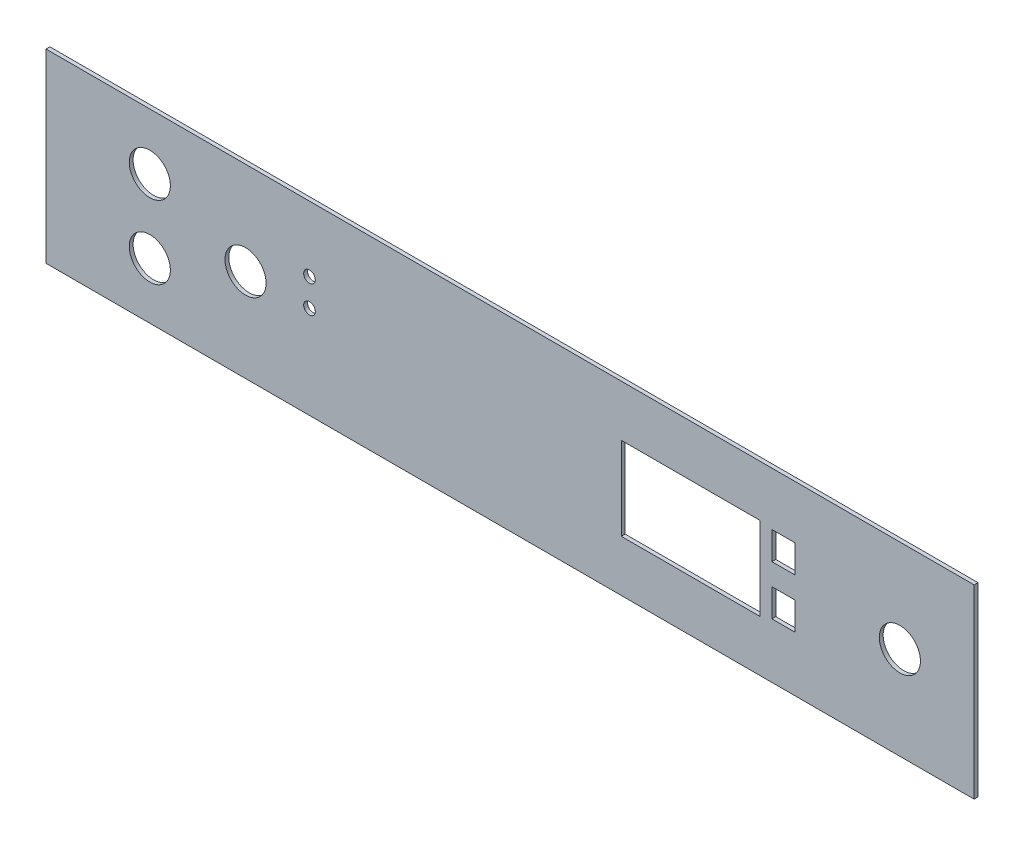
from build123d import *

# Parameters (mm, degrees)
SKETCH1_W             = 508
SKETCH1_H             = 101.6
FRONT_PANEL_DEPTH     = 2.1
SKETCH2_R             = 11.25
START_STOP_DEPTH      = 260.038703672
SKETCH3_R             = 11.25
SKETCH3_R_2           = 3.175
MODE_SELECT_DEPTH     = 260.038703672
SKETCH4_W             = 76
SKETCH4_H             = 45.5
LCD_CUTOUT_DEPTH      = 260.038703672
SKETCH5_R             = 11.25
E_STOP_CUTOUT_DEPTH   = 260.038703672
SKETCH6_W             = 12.7
SKETCH6_H             = 15.24
LCD_PUSHBUTTONS_DEPTH = 260.038703672


with BuildPart() as part:
    # Sketch1 → Front panel (new body)
    with BuildSketch(Plane.XY):
        Rectangle(SKETCH1_W, SKETCH1_H)
    extrude(amount=FRONT_PANEL_DEPTH)

    # Sketch2 → Start/stop (cut, through all)
    with BuildSketch(Plane.XY.offset(2.1)):
        with Locations((-197.18192255, 20)):
            Circle(SKETCH2_R)
        with Locations((-197.18192255, -20)):
            Circle(SKETCH2_R)
    extrude(amount=-START_STOP_DEPTH, mode=Mode.SUBTRACT)

    # Sketch3 → Mode select (cut, through all)
    with BuildSketch(Plane.XY.offset(2.1)):
        with Locations((-144.789831958, 0)):
            Circle(SKETCH3_R)
        with Locations((-109.789831958, 15)):
            Circle(SKETCH3_R_2)
        with Locations((-109.789831958, 0)):
            Circle(SKETCH3_R_2)
    extrude(amount=-MODE_SELECT_DEPTH, mode=Mode.SUBTRACT)

    # Sketch4 → LCD cutout (cut, through all)
    with BuildSketch(Plane.XY.offset(2.1)):
        with Locations((98.860146723, 0)):
            Rectangle(SKETCH4_W, SKETCH4_H)
    extrude(amount=-LCD_CUTOUT_DEPTH, mode=Mode.SUBTRACT)

    # Sketch5 → E-stop cutout (cut, through all)
    with BuildSketch(Plane.XY.offset(2.1)):
        with Locations((213.338837131, 0)):
            Circle(SKETCH5_R)
    extrude(amount=-E_STOP_CUTOUT_DEPTH, mode=Mode.SUBTRACT)

    # Sketch6 → LCD pushbuttons (cut, through all)
    with BuildSketch(Plane.XY.offset(2.1)):
        with Locations((149.670146723, 14.0825)):
            Rectangle(SKETCH6_W, SKETCH6_H)
        with Locations((149.670146723, -13.035)):
            Rectangle(SKETCH6_W, SKETCH6_H)
    extrude(amount=-LCD_PUSHBUTTONS_DEPTH, mode=Mode.SUBTRACT)


solid = part.part
